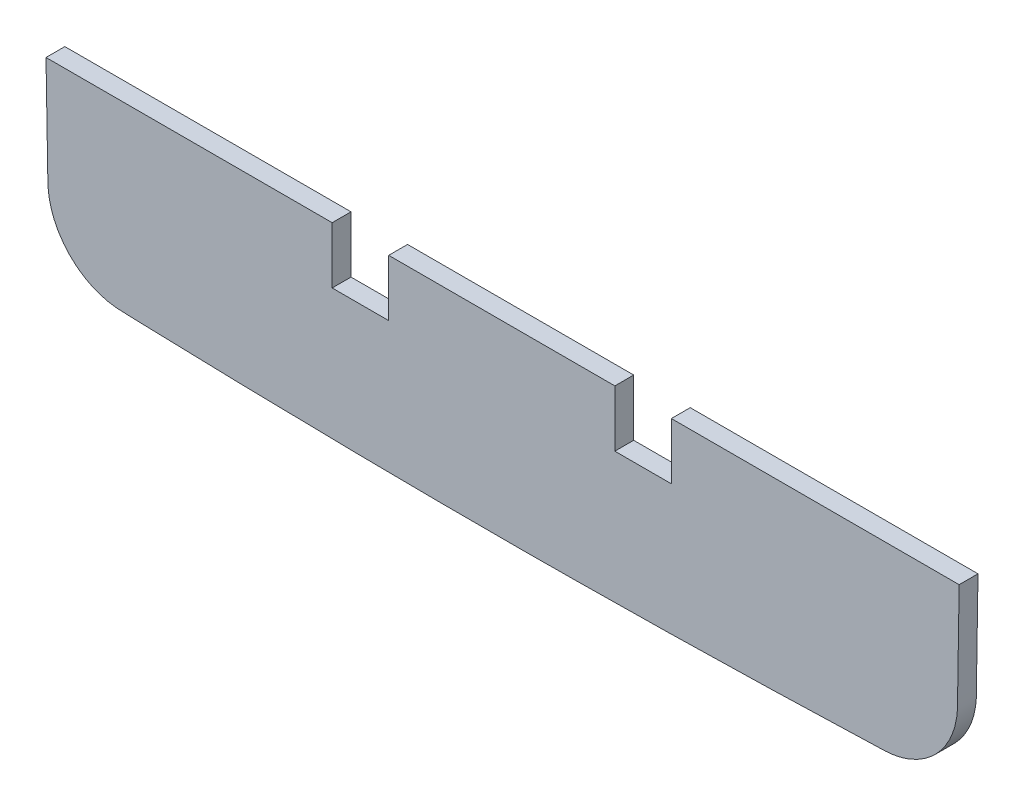
from build123d import *

# Parameters (mm, degrees)
BOSS_EXTRUDE1_DEPTH = 2.54


with BuildPart() as part:
    # Sketch1 → Boss-Extrude1 (new body)
    with BuildSketch(Plane.XY):
        with BuildLine():
            Line((40.64, -46.081453176), (40.64, -38.461453176))
            Line((40.64, -38.461453176), (2.071835921, -38.461453176))
            add(Edge.make_bspline(
                [(125.143191794, -38.461453176), (125.108605027, -41.131422954), (125.07151076, -43.724080309), (125.032732975, -46.239477948), (125.013634921, -47.478310905), (124.994124924, -48.698407783), (124.974289942, -49.899778677), (124.964372452, -50.500464125), (124.954373615, -51.096468074), (124.944303717, -51.687791776), (124.939268768, -51.983453627), (124.934216048, -52.277945417), (124.929146806, -52.5712673), (124.926612185, -52.717928242), (124.924724807, -52.864214048), (124.912859623, -53.157375595), (124.903778212, -53.304082482), (124.891561343, -53.450733177), (124.793826395, -54.623938741), (124.494696496, -55.792174765), (124.003814596, -56.871682977), (123.758373646, -57.411437083), (123.466235294, -57.929244724), (123.134717191, -58.416023112), (122.96895814, -58.659412306), (122.793345642, -58.895059885), (122.608744234, -59.121922898), (122.516443529, -59.235354404), (122.421895082, -59.346590718), (122.276858299, -59.509965294), (122.227976987, -59.563843563), (122.153870848, -59.643768213), (122.129038104, -59.670260975), (122.09159535, -59.709774108), (122.079082159, -59.722907485), (122.060264263, -59.742550697), (122.053983613, -59.749088959), (122.044550647, -59.758882095), (122.041404327, -59.762144097), (122.035107696, -59.768663342), (122.032875952, -59.770972134), (122.028805082, -59.775175445), (120.98666244, -60.851222995), (119.711166162, -61.681427207), (118.367094847, -62.196717565), (117.69505919, -62.454362744), (117.005703836, -62.63550672), (116.318574308, -62.743897254), (115.975009544, -62.798092521), (115.631989078, -62.834097848), (115.291883702, -62.852372299), (115.121831013, -62.861509524), (114.952588186, -62.865965872), (114.61405175, -62.87773609), (114.444953034, -62.883595392), (114.276023178, -62.889428826), (111.573145482, -62.982763779), (108.913467465, -63.069468881), (106.294541991, -63.149350538), (101.056691044, -63.309113852), (95.981324212, -63.441416812), (86.126846688, -63.651145695), (81.347827949, -63.728573437), (76.707562531, -63.780336874), (74.387429822, -63.806218593), (72.10204263, -63.825696916), (69.850517338, -63.839137205), (68.724754693, -63.84585735), (67.60746057, -63.85106838), (65.389623691, -63.858567833), (64.287566291, -63.860856953), (63.196913861, -63.86173249), (54.471694416, -63.86873679), (45.210367016, -63.785331964), (35.349273928, -63.59244706), (30.418727384, -63.496004608), (25.337528182, -63.372518), (20.091008428, -63.222044309), (18.77937849, -63.184425886), (17.457376707, -63.145133101), (16.124703879, -63.10418815), (15.458367466, -63.083715675), (14.78936296, -63.06283025), (14.117650946, -63.041535211), (13.78179494, -63.030887691), (13.445262034, -63.020137774), (12.770832316, -62.998434049), (12.433266677, -62.989706702), (12.094311522, -62.976158821), (10.738490903, -62.921967299), (9.330264014, -62.584771663), (8.024921394, -61.937995017), (7.372250083, -61.614606694), (6.745477315, -61.216037436), (6.165105906, -60.751173035), (5.874920201, -60.518740835), (5.596347309, -60.269741154), (5.332025487, -60.005322847), (5.199864576, -59.873113694), (5.071286817, -59.737031313), (4.884081768, -59.527525022), (4.822622584, -59.45679361), (4.731880913, -59.349408989), (4.701874876, -59.313399534), (4.657231782, -59.259070568), (4.642411745, -59.240908449), (4.620273704, -59.213587462), (4.612909693, -59.204467498), (4.601886746, -59.190768211), (4.598216275, -59.186198559), (4.590883033, -59.177052826), (4.586376327, -59.171420523), (4.583561349, -59.167897459), (3.862926825, -58.265992947), (3.283351943, -57.227341071), (2.898689852, -56.121549183), (2.706358807, -55.56865324), (2.561476464, -54.999187331), (2.465104553, -54.42324433), (2.416918598, -54.135272829), (2.380858701, -53.845698266), (2.357048034, -53.55588137), (2.3451427, -53.410972922), (2.336299572, -53.266004938), (2.324767286, -52.976302772), (2.322766389, -52.831703758), (2.319928195, -52.686691958), (2.274517101, -50.366503153), (2.229907174, -47.970176817), (2.14699913, -43.21710159), (2.108481803, -40.871729731), (2.071835921, -38.461453176)],
                knots=[0.352714022, 0.352714022, 0.352714022, 0.352714022, 0.355828221, 0.355828221, 0.355828221, 0.36196319, 0.36196319, 0.36196319, 0.36809816, 0.36809816, 0.36809816, 0.374233129, 0.374233129, 0.374233129, 0.380368098, 0.380368098, 0.386503067, 0.386503067, 0.386503067, 0.392638037, 0.392638037, 0.392638037, 0.398773006, 0.398773006, 0.398773006, 0.404907975, 0.404907975, 0.404907975, 0.411042945, 0.411042945, 0.417177914, 0.417177914, 0.423312883, 0.423312883, 0.429447853, 0.429447853, 0.435582822, 0.435582822, 0.441717791, 0.441717791, 0.447852761, 0.447852761, 0.447852761, 0.45398773, 0.45398773, 0.45398773, 0.460122699, 0.460122699, 0.460122699, 0.466257669, 0.466257669, 0.466257669, 0.472392638, 0.472392638, 0.478527607, 0.478527607, 0.478527607, 0.484662577, 0.484662577, 0.484662577, 0.490797546, 0.490797546, 0.496932515, 0.496932515, 0.496932515, 0.503067485, 0.503067485, 0.503067485, 0.509202454, 0.509202454, 0.515337423, 0.515337423, 0.515337423, 0.521472393, 0.521472393, 0.521472393, 0.527607362, 0.527607362, 0.527607362, 0.533742331, 0.533742331, 0.533742331, 0.539877301, 0.539877301, 0.539877301, 0.54601227, 0.54601227, 0.552147239, 0.552147239, 0.552147239, 0.558282209, 0.558282209, 0.558282209, 0.564417178, 0.564417178, 0.564417178, 0.570552147, 0.570552147, 0.570552147, 0.576687117, 0.576687117, 0.582822086, 0.582822086, 0.588957055, 0.588957055, 0.595092025, 0.595092025, 0.601226994, 0.601226994, 0.607361963, 0.607361963, 0.613496933, 0.613496933, 0.613496933, 0.619631902, 0.619631902, 0.619631902, 0.625766871, 0.625766871, 0.625766871, 0.63190184, 0.63190184, 0.63190184, 0.63803681, 0.63803681, 0.644171779, 0.644171779, 0.644171779, 0.650306748, 0.650306748, 0.655965275, 0.655965275, 0.655965275, 0.655965275], degree=3))
            Line((125.143191794, -38.461453176), (86.36, -38.461453176))
            Line((86.36, -38.461453176), (86.36, -46.081453176))
            Line((86.36, -46.081453176), (78.74, -46.081453176))
            Line((78.74, -46.081453176), (78.74, -38.461453176))
            Line((78.74, -38.461453176), (48.26, -38.461453176))
            Line((48.26, -38.461453176), (48.26, -46.081453176))
            Line((48.26, -46.081453176), (40.64, -46.081453176))
        make_face()
    extrude(amount=BOSS_EXTRUDE1_DEPTH)


solid = part.part
